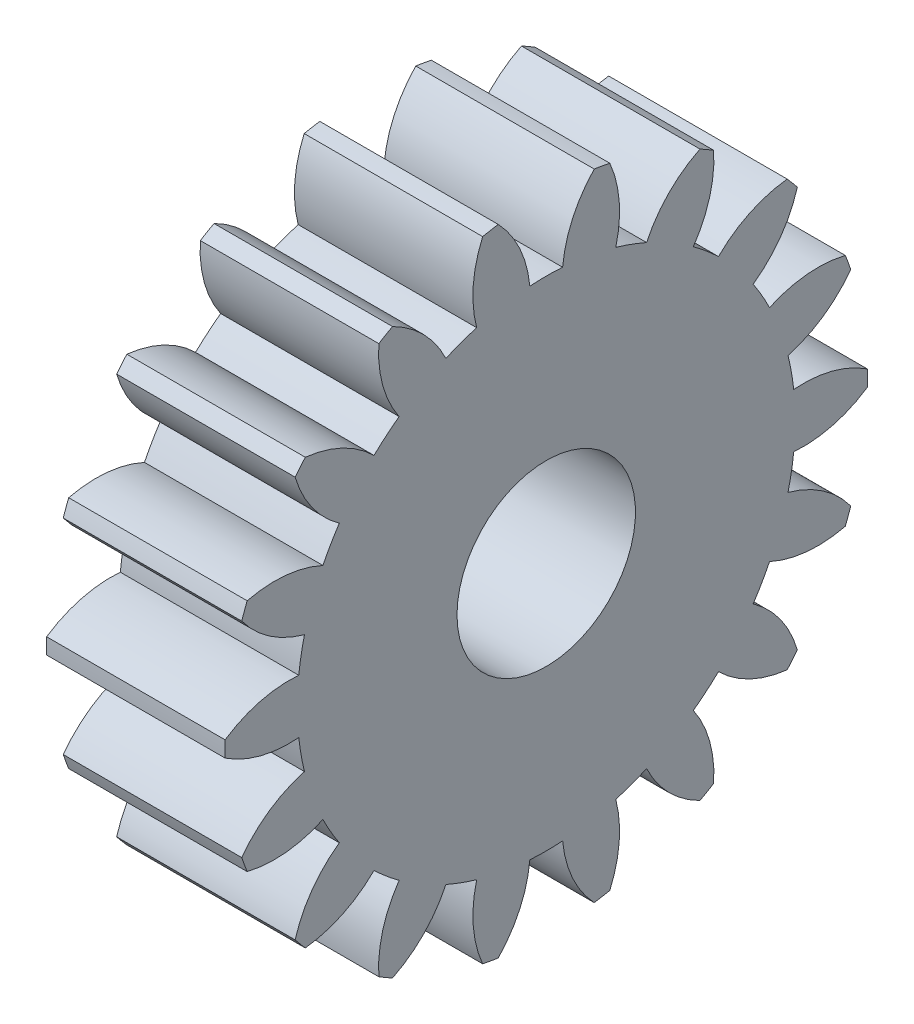
from build123d import *

# Parameters (mm, degrees)
BASPROSKE_W     = 5
BASPROSKE_H     = 9
TOOTHCUT_DEPTH  = 14.674794331
TEETHCUTS_COUNT = 18
TEETHCUTS_ANGLE = 340
BORSKE_R        = 2.5
BORE_DEPTH      = 50.0000508


with BuildPart() as part:
    # BasProSke → Base-Revolve (revolve)
    with BuildSketch(Plane(origin=(0, 0, 0), x_dir=(1, 0, 0), z_dir=(0, 1, 0))):
        with Locations((2.5, 4.5)):
            Rectangle(BASPROSKE_W, BASPROSKE_H)
    revolve(axis=Axis((-10, 0, 0), (1, 0, 0)))

    # TooCutSke → ToothCut (cut, through all)
    with BuildSketch(Plane(origin=(0, 0, 0), x_dir=(0, 0, -1), z_dir=(1, 0, 0))):
        with BuildLine():
            ThreePointArc((0.45926649, 6.958861278), (0, 6.974), (-0.45926649, 6.958861278))
            ThreePointArc((-0.45926649, 6.958861278), (-0.743858876, 8.01799277), (-1.365479267, 8.921508366))
            ThreePointArc((-1.365479267, 8.921508366), (0, 9.0254), (1.365479267, 8.921508366))
            ThreePointArc((1.365479267, 8.921508366), (0.743858876, 8.01799277), (0.45926649, 6.958861278))
        make_face()
    toothcut = extrude(amount=TOOTHCUT_DEPTH, mode=Mode.SUBTRACT)

    # TeethCuts: ToothCut ×18 about axis
    teethcuts_axis = Axis((-10, 0, 0), (1, 0, 0))
    for i in range(1, TEETHCUTS_COUNT):
        add(toothcut.rotate(teethcuts_axis, i * TEETHCUTS_ANGLE / (TEETHCUTS_COUNT - 1)), mode=Mode.SUBTRACT)

    # BorSke → Bore (cut, symmetric)
    with BuildSketch(Plane(origin=(0, 0, 0), x_dir=(0, 0, -1), z_dir=(1, 0, 0))):
        Circle(BORSKE_R)
    extrude(amount=BORE_DEPTH, both=True, mode=Mode.SUBTRACT)


solid = part.part
